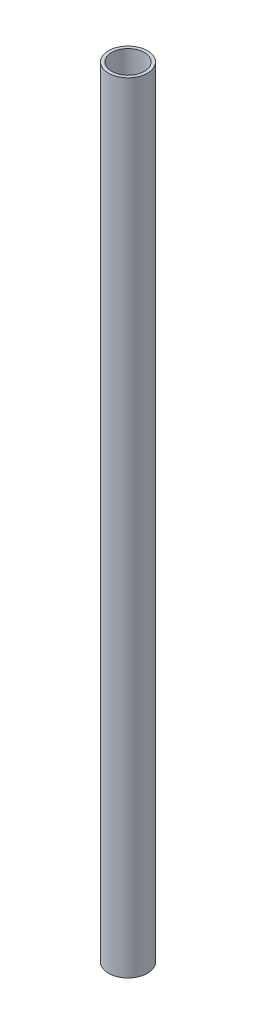
from build123d import *

# Parameters (mm, degrees)
SKETCH1_R           = 12.5
SKETCH1_R_2         = 10.5
BOSS_EXTRUDE1_DEPTH = 500


with BuildPart() as part:
    # Sketch1 → Boss-Extrude1 (new body)
    with BuildSketch(Plane(origin=(0, 0, 0), x_dir=(1, 0, 0), z_dir=(0, 1, 0))):
        Circle(SKETCH1_R)
        Circle(SKETCH1_R_2, mode=Mode.SUBTRACT)
    extrude(amount=BOSS_EXTRUDE1_DEPTH)


solid = part.part
